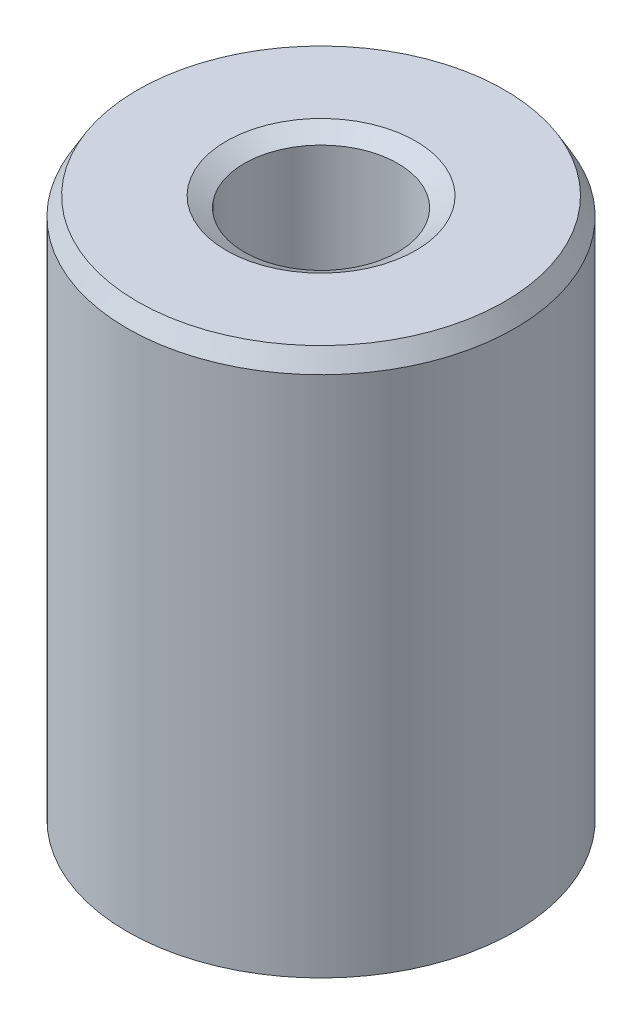
from build123d import *
from OCP.BRepFilletAPI import BRepFilletAPI_MakeChamfer

# Parameters (mm, degrees)
SKETCH1_R           = 20
BOSS_EXTRUDE1_DEPTH = 56.825706659
SKETCH2_R           = 7.924808968
CUT_EXTRUDE1_DEPTH  = 64.475672011
CHAMFER1_SIZE       = 1.851550147
CHAMFER1_SIZE2      = 1.068992976


with BuildPart() as part:
    # Sketch1 → Boss-Extrude1 (new body)
    with BuildSketch(Plane(origin=(0, 0, 0), x_dir=(1, 0, 0), z_dir=(0, 1, 0))):
        Circle(SKETCH1_R)
    extrude(amount=BOSS_EXTRUDE1_DEPTH)

    # Sketch2 → Cut-Extrude1 (cut, through all)
    with BuildSketch(Plane(origin=(0, 0, 0), x_dir=(1, 0, 0), z_dir=(0, 1, 0))):
        Circle(SKETCH2_R)
    extrude(amount=CUT_EXTRUDE1_DEPTH, mode=Mode.SUBTRACT)

    # Chamfer1: one chamfer whose edges measure the first distance from different faces: ONE call of the kernel's chamfer builder (chamfer() names one face for all edges)
    chamfer1_edges_1 = [part.edges().sort_by_distance(p)[0] for p in [
        (-7.924808968, 56.825706659, 0),
    ]]
    chamfer1_side_1 = [part.faces().sort_by_distance(p)[0] for p in [
        (-19.434314575, 56.825706659, 0),
    ]]
    chamfer1_edges_2 = [part.edges().sort_by_distance(p)[0] for p in [
        (-7.924808968, 0, 0),
    ]]
    chamfer1_side_2 = [part.faces().sort_by_distance(p)[0] for p in [
        (-7.924808968, 28.412853329, 0),
    ]]
    chamfer1_edges_3 = [part.edges().sort_by_distance(p)[0] for p in [
        (-20, 0, 0),
    ]]
    chamfer1_side_3 = [part.faces().sort_by_distance(p)[0] for p in [
        (-19.434314575, 0, 0),
    ]]
    chamfer1_edges_4 = [part.edges().sort_by_distance(p)[0] for p in [
        (-20, 56.825706659, 0),
    ]]
    chamfer1_side_4 = [part.faces().sort_by_distance(p)[0] for p in [
        (-20, 28.412853329, 0),
    ]]
    chamfer1 = BRepFilletAPI_MakeChamfer(part.part.solid().wrapped)
    for e in chamfer1_edges_1:
        chamfer1.Add(CHAMFER1_SIZE, CHAMFER1_SIZE2, e.wrapped, chamfer1_side_1[0].wrapped)  # the first distance lies on this face
    for e in chamfer1_edges_2:
        chamfer1.Add(CHAMFER1_SIZE, CHAMFER1_SIZE2, e.wrapped, chamfer1_side_2[0].wrapped)  # the first distance lies on this face
    for e in chamfer1_edges_3:
        chamfer1.Add(CHAMFER1_SIZE, CHAMFER1_SIZE2, e.wrapped, chamfer1_side_3[0].wrapped)  # the first distance lies on this face
    for e in chamfer1_edges_4:
        chamfer1.Add(CHAMFER1_SIZE, CHAMFER1_SIZE2, e.wrapped, chamfer1_side_4[0].wrapped)  # the first distance lies on this face
    add(Compound.cast(chamfer1.Shape()), mode=Mode.REPLACE)


solid = part.part
